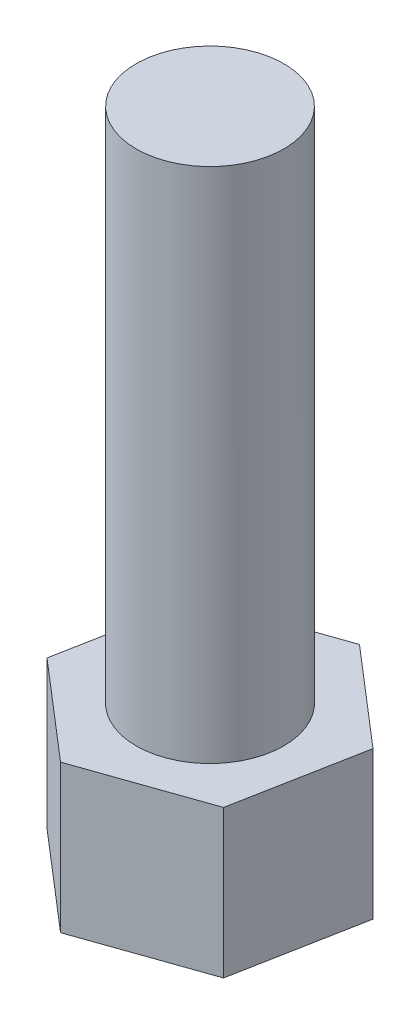
from build123d import *

# Parameters (mm, degrees)
OTHER_M2_OUTLINE_R   = 1
OTHER_M2_DEPTH       = 5
OTHER_M2_2_OUTLINE_R = 1
OTHER_M2_2_DEPTH     = 2
SKETCH_2_R           = 1
EXTRUDE_1_DEPTH      = 4


# Read off the part's stored shape, not the designer's step: M2螺栓镜向
with BuildPart() as part:
    # Other M2 outline → Other M2 (new body)
    with BuildSketch(Plane(origin=(0, 0, 0), x_dir=(1, 0, 0), z_dir=(0, 1, 0))):
        Circle(OTHER_M2_OUTLINE_R)
    extrude(amount=OTHER_M2_DEPTH)

    # Other M2 2 outline → Other M2 2 (add)
    with BuildSketch(Plane(origin=(0, 0, 0), x_dir=(1, 0, 0), z_dir=(0, 1, 0))):
        Polygon((1.634810628, 0.57218372), (0.321879677, 1.701879395), (-1.312930951, 1.129695675), (-1.634810628, -0.57218372), (-0.321879677, -1.701879395), (1.312930951, -1.129695675), align=None)
        Circle(OTHER_M2_2_OUTLINE_R, mode=Mode.SUBTRACT)
    extrude(amount=OTHER_M2_2_DEPTH)

    # 草图2 → 凸台-拉伸1 (add)
    with BuildSketch(Plane(origin=(0, 5, 0), x_dir=(1, 0, 0), z_dir=(0, 1, 0))):
        with Locations(Location((0, 0, 0), (0, 0, 270))):
            Circle(SKETCH_2_R)
    extrude(amount=EXTRUDE_1_DEPTH)


solid = part.part
